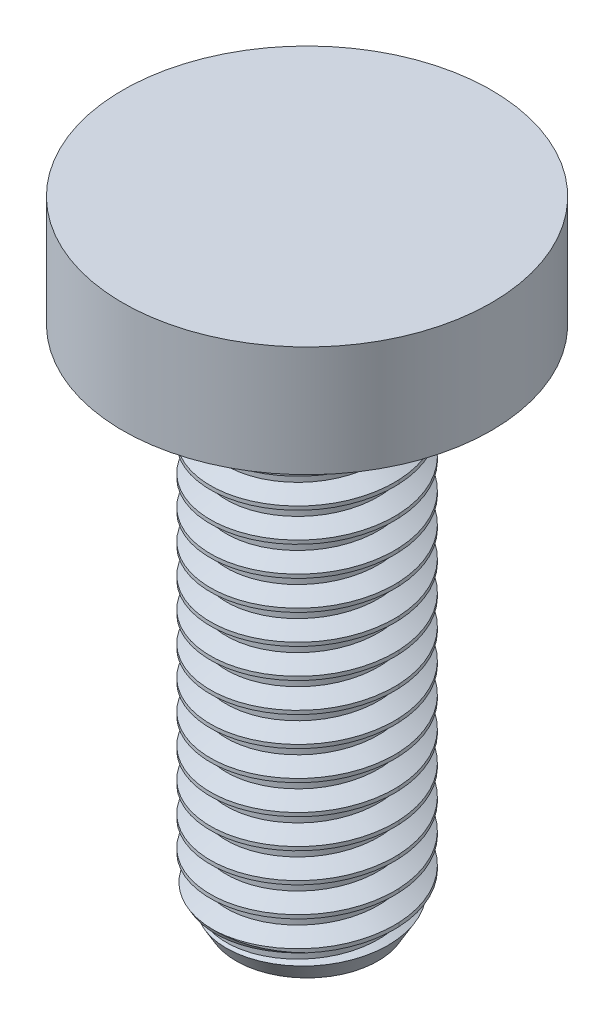
from build123d import *

# Parameters (mm, degrees)
CHAMFER_1_SIZE  = 1
CHAMFER_1_SIZE2 = 0.577350269
THREAD_1_PITCH  = 0.8


with BuildPart() as part:
    # Эскиз1 → Повернуть1 (revolve)
    with BuildSketch(Plane.XY, mode=Mode.PRIVATE) as revolve_1_sk:
        Polygon((0, 3), (-5, 3), (-5, 0), (-2.5, 0), (-2.5, -14), (0, -14), align=None)
    revolve(revolve_1_sk.sketch.rotate(Axis((0, -14, 0), (0, 1, 0)), 180), axis=Axis((0, -14, 0), (0, 1, 0)))

    # Фаска1
    chamfer_1_edges = [part.edges().sort_by_distance(p)[0] for p in [
        (-2.5, -14, 0),
    ]]
    chamfer_1_side = [part.faces().sort_by_distance(p)[0] for p in [
        (-2.5, -7, 0),
    ]]
    chamfer(chamfer_1_edges, length=CHAMFER_1_SIZE, length2=CHAMFER_1_SIZE2, reference=chamfer_1_side[0])

    # Резьба1: arcs per turn and ends read off the stored shape
    # Резьба1: the profile of Профиль резьбы2 profile screwed along a right-hand helix through 18.125 turns, 8 arcs to a turn; built about Z, then put on its axis
    thread_1_z = Axis((0, 0, 0), (0, 0, 1))
    thread_1_corners = [(2.5003, 0, -0.000173205), (2.5003, 0, 0.700173203), (2.0669873, 0, 0.449999999), (2.0669873, 0, 0.249999999)]
    with BuildLine(mode=Mode.PRIVATE) as thread_1_profile:
        Line(thread_1_corners[0], thread_1_corners[1])
        Line(thread_1_corners[1], thread_1_corners[2])
        Line(thread_1_corners[2], thread_1_corners[3])
        Line(thread_1_corners[3], thread_1_corners[0])
    thread_1_cap = Face(thread_1_profile.wire())
    thread_1_turn_angles = [0, 22.5, 45, 67.5, 90, 112.5, 135, 157.5, 180, 202.5, 225, 247.5, 270, 292.5, 315, 337.5, 360]
    thread_1_turn_weights = [1, 0.9238795325112867, 1, 0.9238795325112867, 1, 0.9238795325112867, 1, 0.9238795325112867, 1, 0.9238795325112867, 1, 0.9238795325112867, 1, 0.9238795325112867, 1, 0.9238795325112867, 1]
    thread_1_turn_rails = [Edge.make_bspline([Vector(p[0], p[1], 0).rotate(thread_1_z, thread_1_turn_angles[k]) / thread_1_turn_weights[k] + Vector(0, 0, p[2] + THREAD_1_PITCH * thread_1_turn_angles[k] / 360) for k in range(17)], [0, 0, 0, 1, 1, 2, 2, 3, 3, 4, 4, 5, 5, 6, 6, 7, 7, 8, 8, 8], 2, thread_1_turn_weights) for p in thread_1_corners]
    thread_1_turn_sides = [Face.make_surface_from_curves(thread_1_turn_rails[p[0]], thread_1_turn_rails[p[1]]) for p in [(0, 1), (1, 2), (2, 3), (3, 0)]]
    thread_1_last_angles = [6480, 6502.5, 6525]
    thread_1_last_weights = [1, 0.9238795325112867, 1]
    thread_1_last_rails = [Edge.make_bspline([Vector(p[0], p[1], 0).rotate(thread_1_z, thread_1_last_angles[k]) / thread_1_last_weights[k] + Vector(0, 0, p[2] + THREAD_1_PITCH * thread_1_last_angles[k] / 360) for k in range(3)], [0, 0, 0, 1, 1, 1], 2, thread_1_last_weights) for p in thread_1_corners]
    thread_1_last_sides = [Face.make_surface_from_curves(thread_1_last_rails[p[0]], thread_1_last_rails[p[1]]) for p in [(0, 1), (1, 2), (2, 3), (3, 0)]]
    thread_1 = Plane(origin=(0, -16, 0), x_dir=(1, 0, 0), z_dir=(0, 1, 0)) * Solid(Shell([*[p.moved(Location((0, 0, THREAD_1_PITCH * i))) for i in range(18) for p in thread_1_turn_sides], *thread_1_last_sides, thread_1_cap, thread_1_cap.rotate(thread_1_z, 6525).moved(Location((0, 0, THREAD_1_PITCH * 6525 / 360)))]))
    add(thread_1, mode=Mode.SUBTRACT)


solid = part.part
